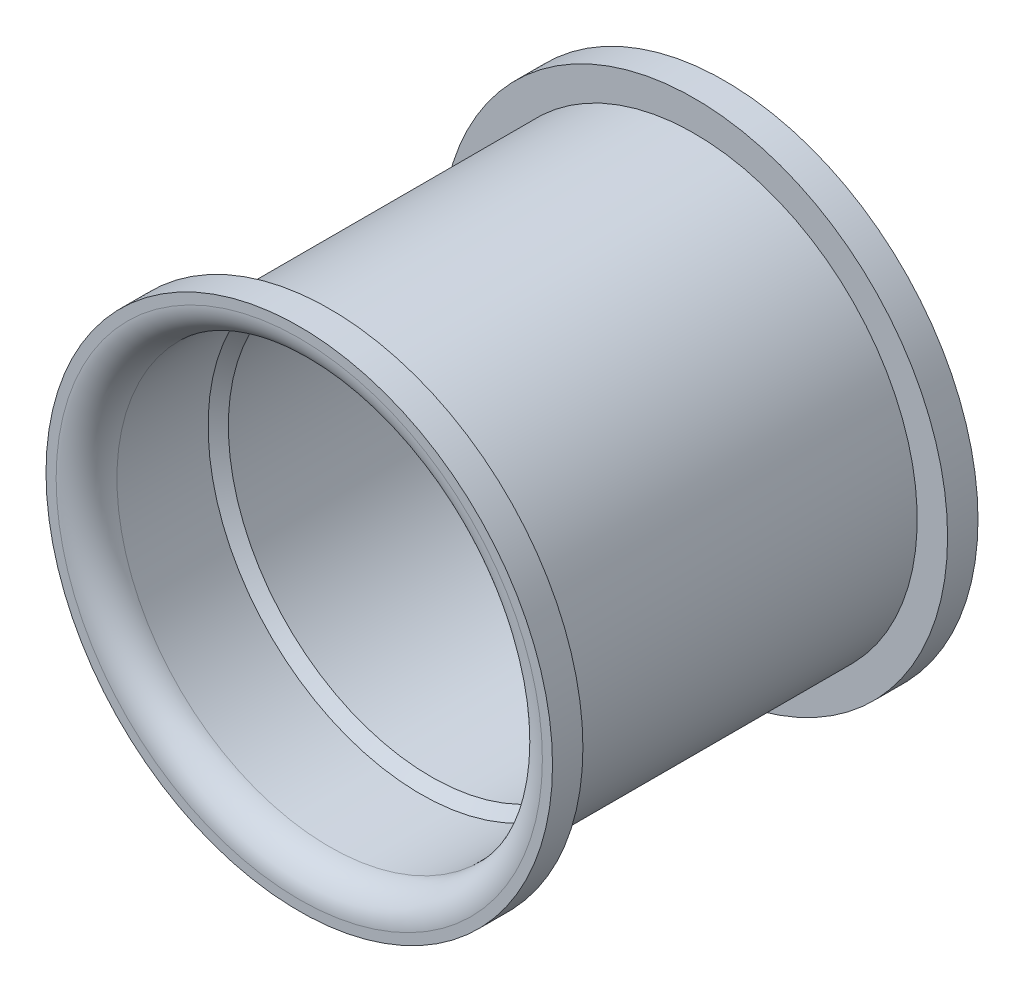
from build123d import *

# Parameters (mm, degrees)
ESBO_O1_R                = 12.5
RESSALTO_EXTRUS_O1_DEPTH = 21
ESBO_O4_W                = 18
ESBO_O4_H                = 1.4999999999999982
ESBO_O5_R                = 9.25
CORTE_EXTRUS_O1_DEPTH    = 14
CORTE_EXTRUS_O2_DEPTH    = 17
ESBO_O7_R                = 2.499999999999999
ESBO_O7_R_2              = 2.5000000000000018
ESBO_O7_R_3              = 2.5
ESBO_O7_R_4              = 2.500000000000001
ESBO_O7_R_5              = 2.5000000000000004
CORTE_EXTRUS_O3_DEPTH    = 17
ESBO_O11_R               = 10
CORTE_EXTRUS_O4_DEPTH    = 23.54994456755936
CHANFRO3_SIZE            = 0.5
FILETE2_R                = 1
ESBO_O12_R               = 4.25
CORTE_EXTRUS_O5_DEPTH    = 4.5
CORTE_EXTRUS_O6_START    = -2
ESBO_O13_R               = 9.999999999998892
CORTE_EXTRUS_O6_DEPTH    = 2
ESBO_O14_R               = 10.5
CORTE_EXTRUS_O7_DEPTH    = 6
CHANFRO5_SIZE            = 0.5
FILETE3_R                = 1.5
FILETE4_R                = 0.5


# Some blends are built 0.0001 mm under size
with BuildPart() as part:
    # Esboço1 → Ressalto-extrusão1 (new body)
    with BuildSketch(Plane.XY):
        with Locations(Location((0, 0, 0), (0, 0, 180))):
            Circle(ESBO_O1_R)
    extrude(amount=RESSALTO_EXTRUS_O1_DEPTH)

    # Esboço4 → Corte-Revolução1 (revolve, cut)
    with BuildSketch(Plane(origin=(0, 0, 0), x_dir=(0, 0, -1), z_dir=(1, 0, 0)), mode=Mode.PRIVATE) as corte_revolu_o1_sk:
        with Locations((-10.5, -11.750000000000004)):
            Rectangle(ESBO_O4_W, ESBO_O4_H)
    revolve(corte_revolu_o1_sk.sketch.rotate(Axis((0, 0, -2.777032731116021), (0, 0, 1)), 270), axis=Axis((0, 0, -2.777032731116021), (0, 0, 1)), mode=Mode.SUBTRACT)

    # Esboço5 → Corte-extrusão1 (cut)
    with BuildSketch(Plane.XY.offset(21)):
        Circle(ESBO_O5_R)
    extrude(amount=-CORTE_EXTRUS_O1_DEPTH, mode=Mode.SUBTRACT)

    # Esboço6 → Corte-extrusão2 (cut)
    with BuildSketch(Plane.XY.offset(7.000000000000001)):
        with BuildLine():
            Line((-1.6492922297361152, 0.04832329595623431), (-0.1960424852505637, 1.6383123462810085))
            ThreePointArc((-0.1960424852505637, 1.6383123462810085), (1.2179209118912084, -1.1131795238765794), (-1.6492922297361152, 0.04832329595623431))
        make_face()
    extrude(amount=-CORTE_EXTRUS_O2_DEPTH, mode=Mode.SUBTRACT)

    # Esboço7 → Corte-extrusão3 (cut)
    with BuildSketch(Plane.XY.offset(7.000000000000001)):
        with Locations((6.2, 0)):
            Circle(ESBO_O7_R)
        with Locations((1.9159053651246736, -5.896550401029952)):
            Circle(ESBO_O7_R_2)
        with Locations((-5.015905365124674, -3.644268564213333)):
            Circle(ESBO_O7_R_3)
        with Locations((-5.0159053651246746, 3.644268564213335)):
            Circle(ESBO_O7_R_4)
        with Locations((1.9159053651246742, 5.8965504010299545)):
            Circle(ESBO_O7_R_5)
    extrude(amount=-CORTE_EXTRUS_O3_DEPTH, mode=Mode.SUBTRACT)

    # Esboço11 → Corte-extrusão4 (cut, through all)
    with BuildSketch(Plane.XY.offset(7.000000000000001)):
        Circle(ESBO_O11_R)
    extrude(amount=CORTE_EXTRUS_O4_DEPTH, mode=Mode.SUBTRACT)

    # Chanfro3
    chanfro3_edges = [part.edges().sort_by_distance(p)[0] for p in [
        (-0.9226673574933396, 0.8433178211186214, 0),
        (1.2179209118912089, -1.1131795238765791, 0),
    ]]
    chamfer(chanfro3_edges, length=CHANFRO3_SIZE)

    # Filete2
    filete2_edges = [part.edges().sort_by_distance(p)[0] for p in [
        (11.000000000000004, -3.79e-15, 19.5),
    ]]
    fillet(filete2_edges, radius=FILETE2_R)

    # Esboço12 → Corte-extrusão5 (cut)
    with BuildSketch(Plane.XY.offset(7.000000000000001)):
        Circle(ESBO_O12_R)
    extrude(amount=-CORTE_EXTRUS_O5_DEPTH, mode=Mode.SUBTRACT)

    # Esboço13 → Corte-extrusão6 (cut)
    with BuildSketch(Plane.XY.offset(7.000000000000001).offset(CORTE_EXTRUS_O6_START)):
        Circle(ESBO_O13_R)
    extrude(amount=CORTE_EXTRUS_O6_DEPTH, mode=Mode.SUBTRACT)

    # Esboço14 → Corte-extrusão7 (cut)
    with BuildSketch(Plane.XY.offset(21)):
        Circle(ESBO_O14_R)
    extrude(amount=-CORTE_EXTRUS_O7_DEPTH, mode=Mode.SUBTRACT)

    # Chanfro5
    chanfro5_edges = [part.edges().sort_by_distance(p)[0] for p in [
        (-10, -3.6e-16, 15),
    ]]
    chamfer(chanfro5_edges, length=CHANFRO5_SIZE - 0.0001)  # a hair under: the kernel refuses the full size

    # Filete3
    filete3_edges = [part.edges().sort_by_distance(p)[0] for p in [
        (-10.49999999999999, -2.18e-15, 21),
    ]]
    fillet(filete3_edges, radius=FILETE3_R)

    # Filete4
    # the kernel refuses this fillet: 0.5 mm, written as the material it takes off along each edge
    with BuildSketch(Plane(origin=(0.0348414521611502, 4.24985718268406, 2.500000000000001), x_dir=(-0.5385482675790525, 0.8425946614402451, 0), z_dir=(0, 0, 1))) as filete4_piece_1:
        with BuildLine():
            CenterArc((0.823792647207476, 0.4943596381730637), FILETE4_R, 157.42158231985286, 103.96421233199169)
            ThreePointArc((0.3621151927317683, 0.6863334072896572), (0.19675498821110124, 0.3348846296367101), (0, 0))
            ThreePointArc((0, 0), (0.3744512032761266, 0.02820180913468155), (0.7489024065522512, 3e-17))
        make_face()
    extrude(amount=4.440007987691346, mode=Mode.SUBTRACT)
    with BuildSketch(Plane(origin=(-4.031087766088941, 1.346414283230858, 2.500000000000001), x_dir=(-0.9677757103313676, -0.2518137694658835, 0), z_dir=(0, 0, 1))) as filete4_piece_2:
        with BuildLine():
            CenterArc((0.8237926472074756, 0.4943596381730638), FILETE4_R, 157.42158231985286, 103.96421233199163)
            ThreePointArc((0.36211519273176773, 0.6863334072896573), (0.19675498821110218, 0.3348846296367097), (0, 0))
            ThreePointArc((0, 0), (0.3744512032761257, 0.02820180913468181), (0.7489024065522503, 3e-17))
        make_face()
    extrude(amount=4.440007987691345, mode=Mode.SUBTRACT)
    with BuildSketch(Plane(origin=(-2.5261907032380004, -3.417727392709064, 2.500000000000001), x_dir=(-0.059570014892305595, -0.9982241298053911, 0), z_dir=(0, 0, 1))) as filete4_piece_3:
        with BuildLine():
            CenterArc((0.8237926472074754, 0.4943596381730636), FILETE4_R, 157.42158231985266, 103.9642123319918)
            ThreePointArc((0.3621151927317685, 0.6863334072896586), (0.19675498821109988, 0.33488462963670823), (0, 0))
            ThreePointArc((0, 0), (0.37445120327612497, 0.02820180913468126), (0.7489024065522498, 0))
        make_face()
    extrude(amount=4.44000798769135, mode=Mode.SUBTRACT)
    with BuildSketch(Plane(origin=(4.052620967741936, 1.2801419030007621, 2.500000000000001), x_dir=(0.6349345763851404, 0.7725659089751646, 0), z_dir=(0, 0, 1))) as filete4_piece_4:
        with BuildLine():
            CenterArc((0.8237926472074759, 0.4943596381730635), FILETE4_R, 157.42158231985277, 103.96421233199169)
            ThreePointArc((0.36211519273176856, 0.6863334072896574), (0.19675498821110185, 0.33488462963671034), (0, 0))
            ThreePointArc((0, 0), (0.37445120327612536, 0.0282018091346815), (0.7489024065522507, 1e-17))
        make_face()
    extrude(amount=4.440007987691347, mode=Mode.SUBTRACT)
    with BuildSketch(Plane(origin=(2.4698160494238595, -3.458685976206616, 2.500000000000001), x_dir=(0.9309594164175853, -0.36512267114413594, 0), z_dir=(0, 0, 1))) as filete4_piece_5:
        with BuildLine():
            CenterArc((0.8237926472074742, 0.49435963817306355), FILETE4_R, 157.4215823198528, 103.96421233199175)
            ThreePointArc((0.36211519273176695, 0.6863334072896573), (0.19675498821110182, 0.3348846296367097), (0, 0))
            ThreePointArc((0, 0), (0.374451203276125, 0.0282018091346814), (0.7489024065522494, 4e-17))
        make_face()
    extrude(amount=4.440007987691345, mode=Mode.SUBTRACT)
    with BuildSketch(Plane(origin=(2.469816049423857, 3.4586859762066187, 2.500000000000001), x_dir=(0.7573556902798542, -0.6530025715115719, 0), z_dir=(0, 0, 1))) as filete4_piece_6:
        with BuildLine():
            CenterArc((0.8216504418457475, 0.4979119689888876), FILETE4_R, 160.79770494401825, 103.96421233199163)
            ThreePointArc((0.34946884369362086, 0.662364206330018), (0.1996774167699546, 0.3180219723627336), (0, 0))
            ThreePointArc((0, 0), (0.38800159753826985, 0.01774826359445502), (0.776003195076539, -3e-17))
        make_face()
    extrude(amount=4.440007987691348, mode=Mode.SUBTRACT)
    with BuildSketch(Plane(origin=(4.052620967741936, -1.2801419030007621, 2.500000000000001), x_dir=(-0.3870065717105284, -0.9220769563614871, 0), z_dir=(0, 0, 1))) as filete4_piece_7:
        with BuildLine():
            CenterArc((0.8216504418457483, 0.4979119689888879), FILETE4_R, 160.7977049440181, 103.96421233199175)
            ThreePointArc((0.3494688436936216, 0.6623642063300196), (0.19967741676995576, 0.3180219723627358), (0, 0))
            ThreePointArc((0, 0), (0.38800159753827046, 0.01774826359445508), (0.7760031950765397, 0))
        make_face()
    extrude(amount=4.440007987691349, mode=Mode.SUBTRACT)
    with BuildSketch(Plane(origin=(0.0348414521611462, -4.24985718268406, 2.500000000000001), x_dir=(-0.9965389054665341, 0.08312767223712024, 0), z_dir=(0, 0, 1))) as filete4_piece_8:
        with BuildLine():
            CenterArc((0.8216504418457475, 0.4979119689888879), FILETE4_R, 160.79770494401836, 103.96421233199152)
            ThreePointArc((0.3494688436936206, 0.6623642063300171), (0.19967741676995457, 0.31802197236273494), (0, 0))
            ThreePointArc((0, 0), (0.3880015975382697, 0.01774826359445501), (0.776003195076539, -1e-17))
        make_face()
    extrude(amount=4.440007987691348, mode=Mode.SUBTRACT)
    with BuildSketch(Plane(origin=(-4.031087766088943, -1.3464142832308554, 2.500000000000001), x_dir=(-0.9677757103313678, 0.2518137694658824, 0), z_dir=(0, 0, 1))) as filete4_piece_9:
        with BuildLine():
            CenterArc((0.8237926472074728, -0.49435963817306383), FILETE4_R, 98.61420534815544, 103.9642123319918)
            ThreePointArc((0.36211519273176607, -0.686333407289658), (0.19675498821110143, -0.334884629636712), (0, 0))
            ThreePointArc((0, 0), (0.37445120327612447, -0.02820180913468116), (0.7489024065522482, -3e-17))
        make_face()
    extrude(amount=4.440007987691345, mode=Mode.SUBTRACT)
    with BuildSketch(Plane(origin=(-2.5261907032380004, 3.4177273927090632, 2.500000000000001), x_dir=(0.8550781298766168, 0.5184991724262514, 0), z_dir=(0, 0, 1))) as filete4_piece_10:
        with BuildLine():
            CenterArc((0.8216504418457481, 0.49791196898888734), FILETE4_R, 160.79770494401822, 103.96421233199158)
            ThreePointArc((0.3494688436936213, 0.6623642063300179), (0.19967741676995546, 0.31802197236273533), (0, 0))
            ThreePointArc((0, 0), (0.3880015975382698, 0.01774826359445526), (0.7760031950765391, -4e-17))
        make_face()
    extrude(amount=4.440007987691348, mode=Mode.SUBTRACT)


solid = part.part
